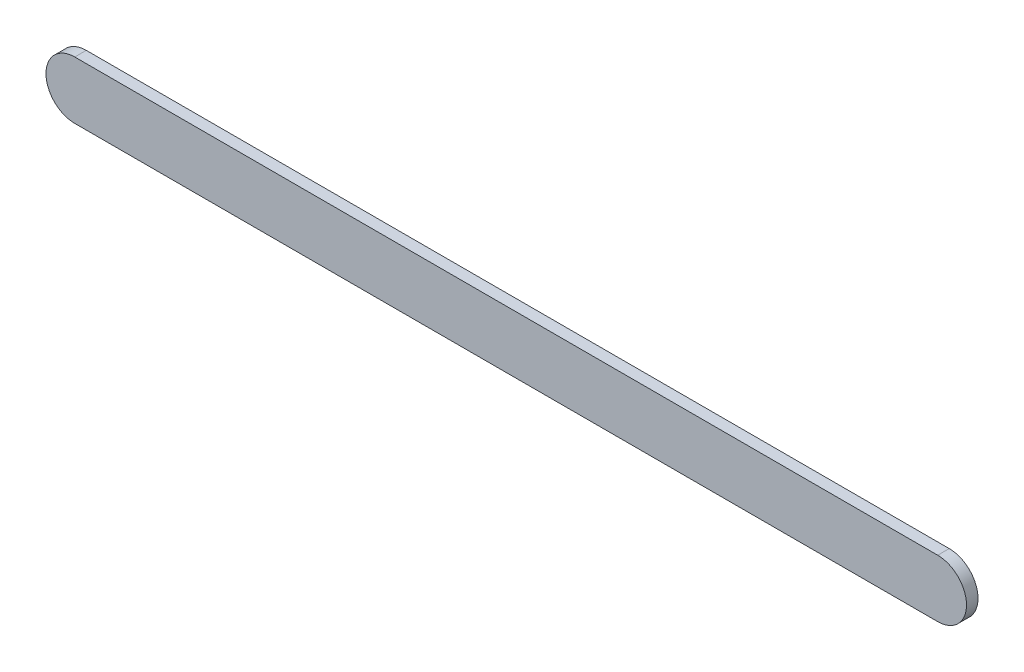
from build123d import *

# Parameters (mm, degrees)
BOSS_EXTRUDE1_DEPTH = 1


with BuildPart() as part:
    # Sketch1 → Boss-Extrude1 (new, symmetric)
    with BuildSketch(Plane.XY):
        with BuildLine():
            Line((0, 5), (150, 5))
            ThreePointArc((150, 5), (155, 0), (150, -5))
            Line((150, -5), (0, -5))
            ThreePointArc((0, -5), (-5, 0), (0, 5))
        make_face()
    extrude(amount=BOSS_EXTRUDE1_DEPTH, both=True)


solid = part.part
